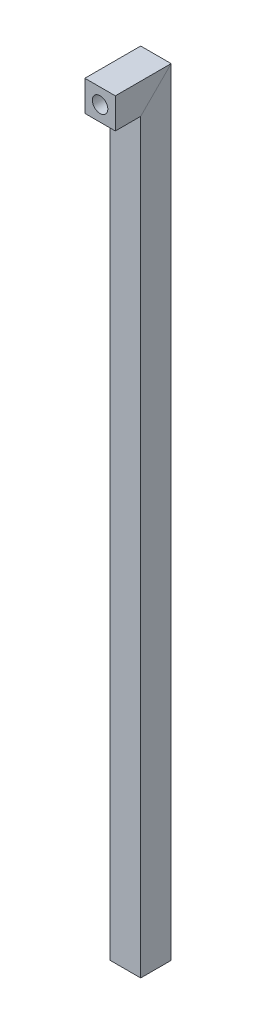
from build123d import *

# Parameters (mm, degrees)
SKETCH1_W           = 12
SKETCH1_H           = 12
SKETCH2_R           = 3.05
CUT_EXTRUDE1_DEPTH  = 16
SKETCH4_W           = 3.346640106
SKETCH4_H           = 1
BOSS_EXTRUDE1_DEPTH = 10
SKETCH5_W           = 10
SKETCH5_H           = 10
CUT_EXTRUDE2_DEPTH  = 294


with BuildPart() as part:
    # Sweep1: sweep along a curve in space
    with BuildLine() as sweep1_path:
        Line((0, 0, 0), (0, 0, -16))
        Line((0, 0, -16), (0, -300, -16))
    # Sketch1 → Sweep1 (sweep)
    with BuildSketch(Plane.XY):
        Rectangle(SKETCH1_W, SKETCH1_H)
    sweep(path=sweep1_path.line, transition=Transition.RIGHT)

    # Sketch2 → Cut-Extrude1 (cut)
    with BuildSketch(Plane.XY):
        Circle(SKETCH2_R)
    extrude(amount=-CUT_EXTRUDE1_DEPTH, mode=Mode.SUBTRACT)

    # Sketch4 → Boss-Extrude1 (add)
    with BuildSketch(Plane.XY.offset(-16)):
        with Locations((0, -3.05)):
            Rectangle(SKETCH4_W, SKETCH4_H)
    extrude(amount=BOSS_EXTRUDE1_DEPTH)

    # Sketch5 → Cut-Extrude2 (cut)
    with BuildSketch(Plane.XZ.offset(300)):
        with Locations((0, -16)):
            Rectangle(SKETCH5_W, SKETCH5_H)
    extrude(amount=-CUT_EXTRUDE2_DEPTH, mode=Mode.SUBTRACT)


solid = part.part
